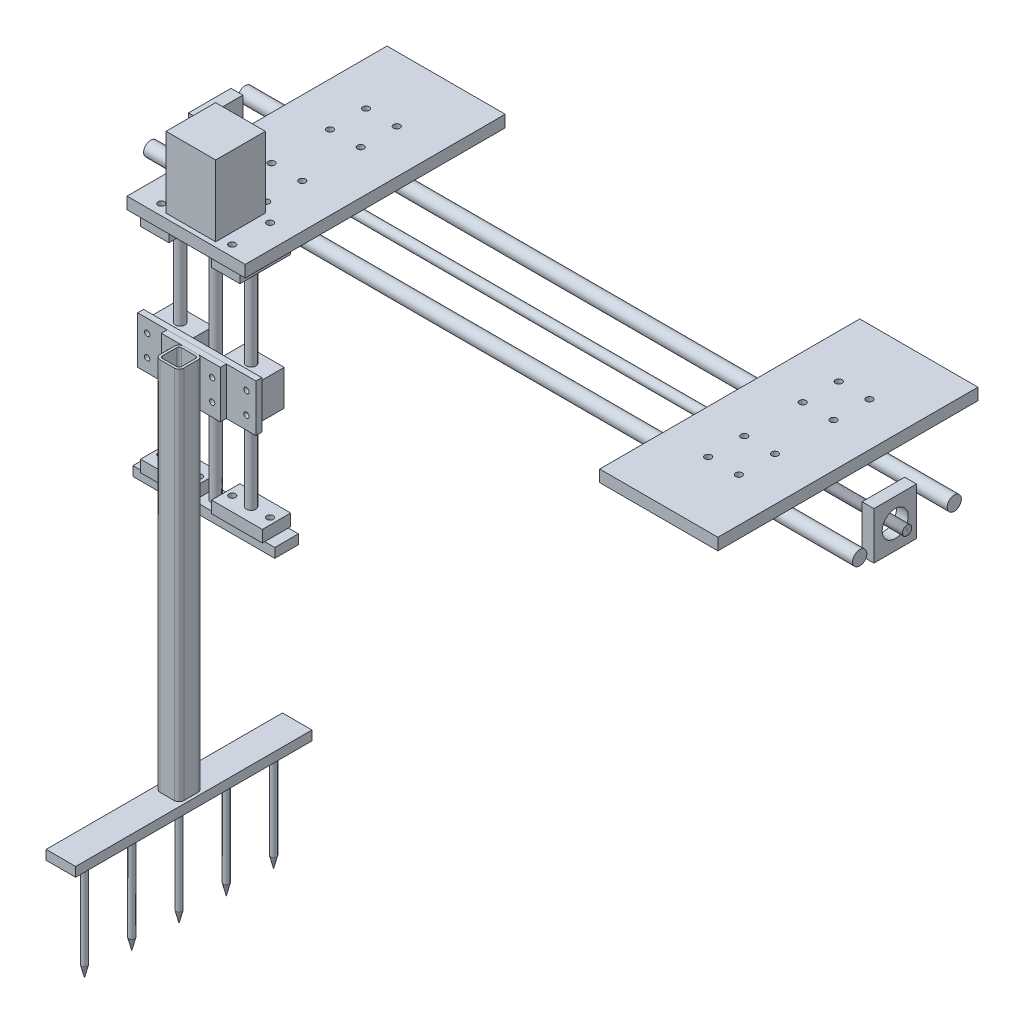
from build123d import *

# Parameters (mm, degrees)
CH_01_MAIN_FRAME_START                       = -260
CH_01_MAIN_FRAME_DEPTH                       = 520
CH_01_MAIN_FRAME_START_2                     = -106.066017178
CH_01_MAIN_FRAME_2_OUTLINE_W                 = 368.933982822
CH_01_MAIN_FRAME_2_OUTLINE_H                 = 22
CH_01_MAIN_FRAME_2_DEPTH                     = 15.066017178
CH_01_MAIN_FRAME_START_3                     = -475
CH_01_MAIN_FRAME_3_OUTLINE_W                 = 16.066017178
CH_01_MAIN_FRAME_3_OUTLINE_H                 = 22
CH_01_MAIN_FRAME_3_DEPTH                     = 368.933982822
CH_01_MAIN_FRAME_4_DEPTH                     = 375
CH_01_MAIN_FRAME_5_DEPTH                     = 375
CH_01_MAIN_FRAME_6_DEPTH                     = 375
CH_01_MAIN_FRAME_7_DEPTH                     = 375
CH_01_MAIN_FRAME_START_4                     = -410
CH_01_MAIN_FRAME_8_DEPTH                     = 820
CH_01_MAIN_FRAME_START_5                     = 106.066017178
CH_01_MAIN_FRAME_9_OUTLINE_W                 = 581.066017178
CH_01_MAIN_FRAME_9_OUTLINE_H                 = 22
CH_01_MAIN_FRAME_9_DEPTH                     = 14.933982822
CH_01_MAIN_FRAME_10_OUTLINE_W                = 15.933982822
CH_01_MAIN_FRAME_10_OUTLINE_H                = 22
CH_01_MAIN_FRAME_10_DEPTH                    = 581.066017178
CH_01_MAIN_FRAME_11_DEPTH                    = 520
CH_01_MAIN_FRAME_START_6                     = 91
CH_01_MAIN_FRAME_12_OUTLINE_W                = 368.933982822
CH_01_MAIN_FRAME_12_OUTLINE_H                = 22
CH_01_MAIN_FRAME_12_DEPTH                    = 15.066017178
CH_01_MAIN_FRAME_13_OUTLINE_W                = 16.066017178
CH_01_MAIN_FRAME_13_OUTLINE_H                = 22
CH_01_MAIN_FRAME_13_DEPTH                    = 368.933982822
CH_01_MAIN_FRAME_14_DEPTH                    = 820
CH_01_MAIN_FRAME_15_OUTLINE_W                = 581.066017178
CH_01_MAIN_FRAME_15_OUTLINE_H                = 22
CH_01_MAIN_FRAME_15_DEPTH                    = 14.933982822
CH_01_MAIN_FRAME_16_OUTLINE_W                = 15.933982822
CH_01_MAIN_FRAME_16_OUTLINE_H                = 22
CH_01_MAIN_FRAME_16_DEPTH                    = 581.066017178
SK_06_X_CARRIAGE_LAYOUT_W                    = 100
SK_06_X_CARRIAGE_LAYOUT_H                    = 220
XA_02_CARRIAGE_PLATES_DEPTH                  = 10
XA_02_CARRIAGE_PLATES_2_DEPTH                = 10
SK_08_X_RAIL_PROFILES_R                      = 6
XA_03_X_GUIDE_RAILS_DEPTH                    = 300
XA_03_X_GUIDE_RAILS_2_DEPTH                  = 300
XA_04_BEARING_HOUSING_01_START               = -200
SK_10_X_BEARING_PROFILE_W                    = 42
SK_10_X_BEARING_PROFILE_H                    = 28
SK_10_X_BEARING_PROFILE_R                    = 6
XA_04_BEARING_HOUSING_01_DEPTH               = 18
SK_11_X_BEARING_MOUNT_HOLES_R                = 2.75
XA_07_X_BEARING_MOUNT_HOLES_DEPTH            = 636.452594613
XA_09_RIGHT_CARRIAGE_HOLES_MIRROR_COPY_1_R   = 2.75
XA_09_RIGHT_CARRIAGE_HOLES_MIRROR_CO_2_DEPTH = 636.452594613
SK_12_X_LEAD_SCREW_PROFILE_R                 = 4
XA_10_X_LEAD_SCREW_DEPTH                     = 300
XA_11_LEFT_LEAD_NUT_START                    = -192.5
SK_13_X_LEAD_NUT_PROFILE_R                   = 5.1
SK_13_X_LEAD_NUT_PROFILE_R_2                 = 4
XA_11_LEFT_LEAD_NUT_DEPTH                    = 11.5
SK_15_LEFT_LEAD_NUT_FLANGE_PROFILE_R         = 11
SK_15_LEFT_LEAD_NUT_FLANGE_PROFILE_R_2       = 4
XA_15_LEFT_LEAD_NUT_FLANGE_DEPTH             = 3.5
SK_16_LEFT_LEAD_NUT_MOUNTING_HOLES_R         = 1.75
XA_16_LEFT_LEAD_NUT_MOUNTING_HOLES_DEPTH     = 3.5
SK_17_X_FIXED_END_SUPPORT_PROFILE_W          = 36
SK_17_X_FIXED_END_SUPPORT_PROFILE_H          = 40
SK_17_X_FIXED_END_SUPPORT_PROFILE_R          = 11
XA_18_X_FIXED_END_SUPPORT_DEPTH              = 10
ZA_02_LEFT_MOTOR_FOOTPRINT_W                 = 42
ZA_02_LEFT_MOTOR_FOOTPRINT_H                 = 42
ZA_03_LEFT_MOTOR_ENVELOPE_DEPTH              = 60
ZA_04_LEFT_LEAD_SCREW_PROFILE_R              = 4
ZA_05_LEFT_VERTICAL_LEAD_SCREW_DEPTH         = 200
ZA_07_LEFT_NUT_PROFILE_R                     = 5.1
ZA_07_LEFT_NUT_PROFILE_R_2                   = 4
ZA_08_LEFT_LEAD_NUT_DEPTH                    = 10
ZA_09_LEFT_GUIDE_ROD_PROFILES_R              = 4
ZA_10_LEFT_VERTICAL_GUIDE_RODS_DEPTH         = 200
ZA_10_LEFT_VERTICAL_GUIDE_RODS_2_DEPTH       = 200
ZA_12_LEFT_SC8UU_PROFILE_W                   = 34
ZA_12_LEFT_SC8UU_PROFILE_H                   = 22
ZA_12_LEFT_SC8UU_PROFILE_R                   = 4
ZA_13_LEFT_SC8UU_HOUSING_DEPTH               = 30
ZA_14_LEFT_SC8UU_MOUNTING_HOLES_PROFILE_R    = 2
ZA_15_LEFT_SC8UU_MOUNTING_HOLES_DEPTH        = 8
ZA_16_LEFT_SC8UU_BEARING_BLOCK_PATTERN_COUNT = 2
ZA_16_LEFT_SC8UU_BEARING_BLOCK_PATTERN_PITCH = 60
ZA_18_BRACKET_VERTICAL_PLATE_PROFILE_W       = 100
ZA_18_BRACKET_VERTICAL_PLATE_PROFILE_H       = 40
ZA_19_BRACKET_VERTICAL_PLATE_DEPTH           = 5
ZA_20_BRACKET_MOUNTING_HOLES_PROFILE_R       = 2.25
ZA_21_BRACKET_MOUNTING_HOLES_DEPTH           = 5
ZA_23_SHELF_PROFILE_W                        = 40
ZA_23_SHELF_PROFILE_H                        = 35
ZA_23_SHELF_PROFILE_R                        = 5
ZA_24_BRACKET_HORIZONTAL_SHELF_DEPTH         = 5
ZA_25_LEFT_NUT_FLANGE_PROFILE_R              = 11
ZA_25_LEFT_NUT_FLANGE_PROFILE_R_2            = 5.1
ZA_25_LEFT_NUT_FLANGE_PROFILE_R_3            = 4
ZA_26_LEFT_NUT_FLANGE_DEPTH                  = 3.5
ZA_27_LEFT_NUT_MOUNTING_HOLES_PROFILE_R      = 1.75
ZA_28_LEFT_NUT_MOUNTING_HOLES_DEPTH          = 3.5
ZA_29_SHELF_NUT_MOUNTING_HOLES_PROFILE_R     = 1.75
ZA_30_SHELF_NUT_MOUNTING_HOLES_DEPTH         = 5
ZA_31_LEFT_SHF8_PROFILE_W                    = 24
ZA_31_LEFT_SHF8_PROFILE_H                    = 43
ZA_31_LEFT_SHF8_PROFILE_R                    = 4
ZA_32_LEFT_SHF8_HOUSING_DEPTH                = 10
ZA_33_LEFT_SHF8_MOUNTING_HOLES_PROFILE_R     = 2.75
ZA_34_LEFT_SHF8_MOUNTING_HOLES_DEPTH         = 10
ZA_36_SHF8_CARRIAGE_MOUNTING_HOLES_R         = 2.75
ZA_37_SHF8_CARRIAGE_MOUNTING_CUT_DEPTH       = 630.046898093
ZA_39_LOWER_BAR_PROFILE_W                    = 120
ZA_39_LOWER_BAR_PROFILE_H                    = 20
ZA_40_LOWER_GUIDE_ROD_CROSSBAR_DEPTH         = 8
ZA_42_LOWER_LEFT_SHF8_ROTATION_ANGLE         = 90
ZA_44_LOWER_BAR_SHF8_MOUNTING_PROFILE_R      = 2.75
ZA_45_LOWER_BAR_SHF8_MOUNTING_CUT_DEPTH      = 556.517776493
RK_01_MOUNTING_FLANGE_PROFILE_W              = 50
RK_01_MOUNTING_FLANGE_PROFILE_H              = 40
RK_01_MOUNTING_FLANGE_PROFILE_R              = 2.25
RK_02_MOUNTING_FLANGE_DEPTH                  = 5
RK_05_SUPPORT_POST_DEPTH                     = 317
RK_08_RAKE_BAR_PROFILE_W                     = 25
RK_08_RAKE_BAR_PROFILE_H                     = 8
RK_09_RAKE_BAR_DEPTH                         = 200
RK_10_FIRST_TINE_PROFILE_R                   = 2.5
RK_11_FIRST_TINE_DEPTH                       = 90
RK_12_FIRST_TINE_TIP_SIZE                    = 10
RK_12_FIRST_TINE_TIP_SIZE2                   = 2.5


with BuildPart() as part:
    # CH_01_Main_Frame: read off the stored shape, not the designer's step
    # CH_01_Main_Frame outline → CH_01_Main_Frame (new body)
    with BuildSketch(Plane.XY.offset(CH_01_MAIN_FRAME_START)):
        with BuildLine():
            ThreePointArc((-390, 391), (-391.171572875, 393.828427125), (-394, 395))
            Line((-394, 395), (-406, 395))
            ThreePointArc((-406, 395), (-408.828427125, 393.828427125), (-410, 391))
            Line((-410, 391), (-410, 379))
            ThreePointArc((-410, 379), (-408.828427125, 376.171572875), (-406, 375))
            Line((-406, 375), (-394, 375))
            ThreePointArc((-394, 375), (-391.171572875, 376.171572875), (-390, 379))
            Line((-390, 379), (-390, 391))
        make_face()
        with BuildLine():
            Line((-408, 379), (-408, 391))
            ThreePointArc((-408, 391), (-407.414213562, 392.414213562), (-406, 393))
            Line((-406, 393), (-394, 393))
            ThreePointArc((-394, 393), (-392.585786438, 392.414213562), (-392, 391))
            Line((-392, 391), (-392, 379))
            ThreePointArc((-392, 379), (-392.585786438, 377.585786438), (-394, 377))
            Line((-394, 377), (-406, 377))
            ThreePointArc((-406, 377), (-407.414213562, 377.585786438), (-408, 379))
        make_face(mode=Mode.SUBTRACT)
    extrude(amount=CH_01_MAIN_FRAME_DEPTH)

    # CH_01_Main_Frame 2 outline → CH_01_Main_Frame 2 (cut)
    with BuildSketch(Plane(origin=(0, 0, 0), x_dir=(0.707106781186548, 0, -0.707106781186547), z_dir=(0.707106781186547, 0, 0.707106781186548)).offset(CH_01_MAIN_FRAME_START_2)):
        with Locations((-290.533008589, 385)):
            Rectangle(CH_01_MAIN_FRAME_2_OUTLINE_W, CH_01_MAIN_FRAME_2_OUTLINE_H)
    extrude(amount=CH_01_MAIN_FRAME_2_DEPTH, mode=Mode.SUBTRACT)

    # CH_01_Main_Frame 3 outline → CH_01_Main_Frame 3 (cut)
    with BuildSketch(Plane(origin=(0, 0, 0), x_dir=(0.707106781186548, 0, -0.707106781186547), z_dir=(0.707106781186547, 0, 0.707106781186548)).offset(CH_01_MAIN_FRAME_START_3)):
        with Locations((-98.033008589, 385)):
            Rectangle(CH_01_MAIN_FRAME_3_OUTLINE_W, CH_01_MAIN_FRAME_3_OUTLINE_H)
    extrude(amount=CH_01_MAIN_FRAME_3_DEPTH, mode=Mode.SUBTRACT)


with BuildPart() as body_2:
    # CH_01_Main_Frame 4 outline → CH_01_Main_Frame 4 (new body)
    with BuildSketch(Plane(origin=(0, 0, 0), x_dir=(1, 0, 0), z_dir=(0, 1, 0))):
        with BuildLine():
            ThreePointArc((-390, 256), (-391.171572875, 258.828427125), (-394, 260))
            Line((-394, 260), (-406, 260))
            ThreePointArc((-406, 260), (-408.828427125, 258.828427125), (-410, 256))
            Line((-410, 256), (-410, 244))
            ThreePointArc((-410, 244), (-408.828427125, 241.171572875), (-406, 240))
            Line((-406, 240), (-394, 240))
            ThreePointArc((-394, 240), (-391.171572875, 241.171572875), (-390, 244))
            Line((-390, 244), (-390, 256))
        make_face()
        with BuildLine():
            Line((-408, 244), (-408, 256))
            ThreePointArc((-408, 256), (-407.414213562, 257.414213562), (-406, 258))
            Line((-406, 258), (-394, 258))
            ThreePointArc((-394, 258), (-392.585786438, 257.414213562), (-392, 256))
            Line((-392, 256), (-392, 244))
            ThreePointArc((-392, 244), (-392.585786438, 242.585786438), (-394, 242))
            Line((-394, 242), (-406, 242))
            ThreePointArc((-406, 242), (-407.414213562, 242.585786438), (-408, 244))
        make_face(mode=Mode.SUBTRACT)
    extrude(amount=CH_01_MAIN_FRAME_4_DEPTH)


with BuildPart() as body_3:
    # CH_01_Main_Frame 5 outline → CH_01_Main_Frame 5 (new body)
    with BuildSketch(Plane(origin=(0, 0, 0), x_dir=(1, 0, 0), z_dir=(0, 1, 0))):
        with BuildLine():
            ThreePointArc((410, 256), (408.828427125, 258.828427125), (406, 260))
            Line((406, 260), (394, 260))
            ThreePointArc((394, 260), (391.171572875, 258.828427125), (390, 256))
            Line((390, 256), (390, 244))
            ThreePointArc((390, 244), (391.171572875, 241.171572875), (394, 240))
            Line((394, 240), (406, 240))
            ThreePointArc((406, 240), (408.828427125, 241.171572875), (410, 244))
            Line((410, 244), (410, 256))
        make_face()
        with BuildLine():
            Line((392, 244), (392, 256))
            ThreePointArc((392, 256), (392.585786438, 257.414213562), (394, 258))
            Line((394, 258), (406, 258))
            ThreePointArc((406, 258), (407.414213562, 257.414213562), (408, 256))
            Line((408, 256), (408, 244))
            ThreePointArc((408, 244), (407.414213562, 242.585786438), (406, 242))
            Line((406, 242), (394, 242))
            ThreePointArc((394, 242), (392.585786438, 242.585786438), (392, 244))
        make_face(mode=Mode.SUBTRACT)
    extrude(amount=CH_01_MAIN_FRAME_5_DEPTH)


with BuildPart() as body_4:
    # CH_01_Main_Frame 6 outline → CH_01_Main_Frame 6 (new body)
    with BuildSketch(Plane(origin=(0, 0, 0), x_dir=(1, 0, 0), z_dir=(0, 1, 0))):
        with BuildLine():
            ThreePointArc((410, -244), (408.828427125, -241.171572875), (406, -240))
            Line((406, -240), (394, -240))
            ThreePointArc((394, -240), (391.171572875, -241.171572875), (390, -244))
            Line((390, -244), (390, -256))
            ThreePointArc((390, -256), (391.171572875, -258.828427125), (394, -260))
            Line((394, -260), (406, -260))
            ThreePointArc((406, -260), (408.828427125, -258.828427125), (410, -256))
            Line((410, -256), (410, -244))
        make_face()
        with BuildLine():
            Line((392, -256), (392, -244))
            ThreePointArc((392, -244), (392.585786438, -242.585786438), (394, -242))
            Line((394, -242), (406, -242))
            ThreePointArc((406, -242), (407.414213562, -242.585786438), (408, -244))
            Line((408, -244), (408, -256))
            ThreePointArc((408, -256), (407.414213562, -257.414213562), (406, -258))
            Line((406, -258), (394, -258))
            ThreePointArc((394, -258), (392.585786438, -257.414213562), (392, -256))
        make_face(mode=Mode.SUBTRACT)
    extrude(amount=CH_01_MAIN_FRAME_6_DEPTH)


with BuildPart() as body_5:
    # CH_01_Main_Frame 7 outline → CH_01_Main_Frame 7 (new body)
    with BuildSketch(Plane(origin=(0, 0, 0), x_dir=(1, 0, 0), z_dir=(0, 1, 0))):
        with BuildLine():
            ThreePointArc((-390, -244), (-391.171572875, -241.171572875), (-394, -240))
            Line((-394, -240), (-406, -240))
            ThreePointArc((-406, -240), (-408.828427125, -241.171572875), (-410, -244))
            Line((-410, -244), (-410, -256))
            ThreePointArc((-410, -256), (-408.828427125, -258.828427125), (-406, -260))
            Line((-406, -260), (-394, -260))
            ThreePointArc((-394, -260), (-391.171572875, -258.828427125), (-390, -256))
            Line((-390, -256), (-390, -244))
        make_face()
        with BuildLine():
            Line((-408, -256), (-408, -244))
            ThreePointArc((-408, -244), (-407.414213562, -242.585786438), (-406, -242))
            Line((-406, -242), (-394, -242))
            ThreePointArc((-394, -242), (-392.585786438, -242.585786438), (-392, -244))
            Line((-392, -244), (-392, -256))
            ThreePointArc((-392, -256), (-392.585786438, -257.414213562), (-394, -258))
            Line((-394, -258), (-406, -258))
            ThreePointArc((-406, -258), (-407.414213562, -257.414213562), (-408, -256))
        make_face(mode=Mode.SUBTRACT)
    extrude(amount=CH_01_MAIN_FRAME_7_DEPTH)


with BuildPart() as body_6:
    # CH_01_Main_Frame 8 outline → CH_01_Main_Frame 8 (new body)
    with BuildSketch(Plane.YZ.offset(CH_01_MAIN_FRAME_START_4)):
        with BuildLine():
            Line((395, -256), (395, -244))
            ThreePointArc((395, -244), (393.828427125, -241.171572875), (391, -240))
            Line((391, -240), (379, -240))
            ThreePointArc((379, -240), (376.171572875, -241.171572875), (375, -244))
            Line((375, -244), (375, -256))
            ThreePointArc((375, -256), (376.171572875, -258.828427125), (379, -260))
            Line((379, -260), (391, -260))
            ThreePointArc((391, -260), (393.828427125, -258.828427125), (395, -256))
        make_face()
        with BuildLine():
            ThreePointArc((393, -256), (392.414213562, -257.414213562), (391, -258))
            Line((391, -258), (379, -258))
            ThreePointArc((379, -258), (377.585786438, -257.414213562), (377, -256))
            Line((377, -256), (377, -244))
            ThreePointArc((377, -244), (377.585786438, -242.585786438), (379, -242))
            Line((379, -242), (391, -242))
            ThreePointArc((391, -242), (392.414213562, -242.585786438), (393, -244))
            Line((393, -244), (393, -256))
        make_face(mode=Mode.SUBTRACT)
    extrude(amount=CH_01_MAIN_FRAME_8_DEPTH)

    # CH_01_Main_Frame 9 outline → CH_01_Main_Frame 9 (cut)
    with BuildSketch(Plane(origin=(0, 0, 0), x_dir=(0.707106781186548, 0, -0.707106781186547), z_dir=(0.707106781186547, 0, 0.707106781186548)).offset(CH_01_MAIN_FRAME_START_5)):
        with Locations((184.466991411, 385)):
            Rectangle(CH_01_MAIN_FRAME_9_OUTLINE_W, CH_01_MAIN_FRAME_9_OUTLINE_H)
    extrude(amount=CH_01_MAIN_FRAME_9_DEPTH, mode=Mode.SUBTRACT)

    # CH_01_Main_Frame 10 outline → CH_01_Main_Frame 10 (cut)
    with BuildSketch(Plane(origin=(0, 0, 0), x_dir=(0.707106781186548, 0, -0.707106781186547), z_dir=(0.707106781186547, 0, 0.707106781186548)).offset(CH_01_MAIN_FRAME_START_3)):
        with Locations((-114.033008589, 385)):
            Rectangle(CH_01_MAIN_FRAME_10_OUTLINE_W, CH_01_MAIN_FRAME_10_OUTLINE_H)
    extrude(amount=CH_01_MAIN_FRAME_10_DEPTH, mode=Mode.SUBTRACT)


with BuildPart() as body_7:
    # CH_01_Main_Frame 11 outline → CH_01_Main_Frame 11 (new body)
    with BuildSketch(Plane.XY.offset(CH_01_MAIN_FRAME_START)):
        with BuildLine():
            Line((406, 395), (394, 395))
            ThreePointArc((394, 395), (391.171572875, 393.828427125), (390, 391))
            Line((390, 391), (390, 379))
            ThreePointArc((390, 379), (391.171572875, 376.171572875), (394, 375))
            Line((394, 375), (406, 375))
            ThreePointArc((406, 375), (408.828427125, 376.171572875), (410, 379))
            Line((410, 379), (410, 391))
            ThreePointArc((410, 391), (408.828427125, 393.828427125), (406, 395))
        make_face()
        with BuildLine():
            ThreePointArc((406, 393), (407.414213562, 392.414213562), (408, 391))
            Line((408, 391), (408, 379))
            ThreePointArc((408, 379), (407.414213562, 377.585786438), (406, 377))
            Line((406, 377), (394, 377))
            ThreePointArc((394, 377), (392.585786438, 377.585786438), (392, 379))
            Line((392, 379), (392, 391))
            ThreePointArc((392, 391), (392.585786438, 392.414213562), (394, 393))
            Line((394, 393), (406, 393))
        make_face(mode=Mode.SUBTRACT)
    extrude(amount=CH_01_MAIN_FRAME_11_DEPTH)

    # CH_01_Main_Frame 12 outline → CH_01_Main_Frame 12 (cut)
    with BuildSketch(Plane(origin=(0, 0, 0), x_dir=(0.707106781186548, 0, -0.707106781186547), z_dir=(0.707106781186547, 0, 0.707106781186548)).offset(CH_01_MAIN_FRAME_START_6)):
        with Locations((290.533008589, 385)):
            Rectangle(CH_01_MAIN_FRAME_12_OUTLINE_W, CH_01_MAIN_FRAME_12_OUTLINE_H)
    extrude(amount=CH_01_MAIN_FRAME_12_DEPTH, mode=Mode.SUBTRACT)

    # CH_01_Main_Frame 13 outline → CH_01_Main_Frame 13 (cut)
    with BuildSketch(Plane(origin=(0, 0, 0), x_dir=(0.707106781186548, 0, -0.707106781186547), z_dir=(0.707106781186547, 0, 0.707106781186548)).offset(CH_01_MAIN_FRAME_START_5)):
        with Locations((98.033008589, 385)):
            Rectangle(CH_01_MAIN_FRAME_13_OUTLINE_W, CH_01_MAIN_FRAME_13_OUTLINE_H)
    extrude(amount=CH_01_MAIN_FRAME_13_DEPTH, mode=Mode.SUBTRACT)


with BuildPart() as body_8:
    # CH_01_Main_Frame 14 outline → CH_01_Main_Frame 14 (new body)
    with BuildSketch(Plane.YZ.offset(CH_01_MAIN_FRAME_START_4)):
        with BuildLine():
            ThreePointArc((391, 240), (393.828427125, 241.171572875), (395, 244))
            Line((395, 244), (395, 256))
            ThreePointArc((395, 256), (393.828427125, 258.828427125), (391, 260))
            Line((391, 260), (379, 260))
            ThreePointArc((379, 260), (376.171572875, 258.828427125), (375, 256))
            Line((375, 256), (375, 244))
            ThreePointArc((375, 244), (376.171572875, 241.171572875), (379, 240))
            Line((379, 240), (391, 240))
        make_face()
        with BuildLine():
            Line((379, 258), (391, 258))
            ThreePointArc((391, 258), (392.414213562, 257.414213562), (393, 256))
            Line((393, 256), (393, 244))
            ThreePointArc((393, 244), (392.414213562, 242.585786438), (391, 242))
            Line((391, 242), (379, 242))
            ThreePointArc((379, 242), (377.585786438, 242.585786438), (377, 244))
            Line((377, 244), (377, 256))
            ThreePointArc((377, 256), (377.585786438, 257.414213562), (379, 258))
        make_face(mode=Mode.SUBTRACT)
    extrude(amount=CH_01_MAIN_FRAME_14_DEPTH)

    # CH_01_Main_Frame 15 outline → CH_01_Main_Frame 15 (cut)
    with BuildSketch(Plane(origin=(0, 0, 0), x_dir=(0.7071067811865471, 0, 0.707106781186548), z_dir=(0.707106781186548, 0, -0.707106781186547)).offset(CH_01_MAIN_FRAME_START_5)):
        with Locations((184.466991411, -385)):
            Rectangle(CH_01_MAIN_FRAME_15_OUTLINE_W, CH_01_MAIN_FRAME_15_OUTLINE_H)
    extrude(amount=CH_01_MAIN_FRAME_15_DEPTH, mode=Mode.SUBTRACT)

    # CH_01_Main_Frame 16 outline → CH_01_Main_Frame 16 (cut)
    with BuildSketch(Plane(origin=(0, 0, 0), x_dir=(0.7071067811865471, 0, 0.707106781186548), z_dir=(0.707106781186548, 0, -0.707106781186547)).offset(CH_01_MAIN_FRAME_START_3)):
        with Locations((-114.033008589, -385)):
            Rectangle(CH_01_MAIN_FRAME_16_OUTLINE_W, CH_01_MAIN_FRAME_16_OUTLINE_H)
    extrude(amount=CH_01_MAIN_FRAME_16_DEPTH, mode=Mode.SUBTRACT)


with BuildPart() as body_9:
    # SK_06_X_Carriage_Layout → XA_02_Carriage_Plates (new body)
    with BuildSketch(Plane(origin=(0, 400, 0), x_dir=(1, 0, 0), z_dir=(0, 1, 0))):
        with Locations((-200, 0)):
            Rectangle(SK_06_X_CARRIAGE_LAYOUT_W, SK_06_X_CARRIAGE_LAYOUT_H)
    extrude(amount=XA_02_CARRIAGE_PLATES_DEPTH)

    # SK_11_X_Bearing_Mount_Holes → XA_07_X_Bearing_Mount_Holes (cut, through all)
    with BuildSketch(Plane(origin=(0, 410, 0), x_dir=(1, 0, 0), z_dir=(0, 1, 0))):
        with Locations(Location((-213, -24.75, 0), (0, 0, 270))):
            Circle(SK_11_X_BEARING_MOUNT_HOLES_R)
        with Locations(Location((-187, -24.75, 0), (0, 0, 270))):
            Circle(SK_11_X_BEARING_MOUNT_HOLES_R)
        with Locations(Location((-187, -55.25, 0), (0, 0, 270))):
            Circle(SK_11_X_BEARING_MOUNT_HOLES_R)
        with Locations(Location((-213, -55.25, 0), (0, 0, 270))):
            Circle(SK_11_X_BEARING_MOUNT_HOLES_R)
    xa_07_x_bearing_mount_holes = extrude(amount=-XA_07_X_BEARING_MOUNT_HOLES_DEPTH, mode=Mode.SUBTRACT)

    # XA_08_X_Bearing_Holes_Mirror: XA_07_X_Bearing_Mount_Holes across plane
    add(xa_07_x_bearing_mount_holes.mirror(Plane.XY), mode=Mode.SUBTRACT)

    # ZA_36_SHF8_Carriage_Mounting_Holes → ZA_37_SHF8_Carriage_Mounting_Cut (cut, through all)
    with BuildSketch(Plane.XZ.offset(-400)):
        with Locations(Location((-170, 69, 0), (0, 0, 270))):
            Circle(ZA_36_SHF8_CARRIAGE_MOUNTING_HOLES_R)
        with Locations(Location((-170, 101, 0), (0, 0, 270))):
            Circle(ZA_36_SHF8_CARRIAGE_MOUNTING_HOLES_R)
        with Locations(Location((-230, 69, 0), (0, 0, 270))):
            Circle(ZA_36_SHF8_CARRIAGE_MOUNTING_HOLES_R)
        with Locations(Location((-230, 101, 0), (0, 0, 270))):
            Circle(ZA_36_SHF8_CARRIAGE_MOUNTING_HOLES_R)
    extrude(amount=-ZA_37_SHF8_CARRIAGE_MOUNTING_CUT_DEPTH, mode=Mode.SUBTRACT)


with BuildPart() as body_10:
    # SK_06_X_Carriage_Layout → XA_02_Carriage_Plates 2 (new body)
    with BuildSketch(Plane(origin=(0, 400, 0), x_dir=(1, 0, 0), z_dir=(0, 1, 0))):
        with Locations((200, 0)):
            Rectangle(SK_06_X_CARRIAGE_LAYOUT_W, SK_06_X_CARRIAGE_LAYOUT_H)
    extrude(amount=XA_02_CARRIAGE_PLATES_2_DEPTH)

    # XA_09_Right_Carriage_Holes_Mirror: XA_07_X_Bearing_Mount_Holes across plane
    add(xa_07_x_bearing_mount_holes.mirror(Plane(origin=(0, 0, 0), x_dir=(0, 0, 1), z_dir=(1, 0, 0))), mode=Mode.SUBTRACT)

    # XA_09_Right_Carriage_Holes_Mirror copy 1 → XA_09_Right_Carriage_Holes_Mirror co 2 (cut, through all)
    with BuildSketch(Plane(origin=(0, 410, 0), x_dir=(-1, 0, 0), z_dir=(0, 1, 0))):
        with Locations(Location((-213, -24.75, 0), (0, 0, 270))):
            Circle(XA_09_RIGHT_CARRIAGE_HOLES_MIRROR_COPY_1_R)
        with Locations(Location((-187, -24.75, 0), (0, 0, 270))):
            Circle(XA_09_RIGHT_CARRIAGE_HOLES_MIRROR_COPY_1_R)
        with Locations(Location((-187, -55.25, 0), (0, 0, 270))):
            Circle(XA_09_RIGHT_CARRIAGE_HOLES_MIRROR_COPY_1_R)
        with Locations(Location((-213, -55.25, 0), (0, 0, 270))):
            Circle(XA_09_RIGHT_CARRIAGE_HOLES_MIRROR_COPY_1_R)
    extrude(amount=-XA_09_RIGHT_CARRIAGE_HOLES_MIRROR_CO_2_DEPTH, mode=Mode.SUBTRACT)


with BuildPart() as body_11:
    # SK_08_X_Rail_Profiles → XA_03_X_Guide_Rails (new, symmetric)
    with BuildSketch(Plane(origin=(0, 0, 0), x_dir=(0, 0, -1), z_dir=(1, 0, 0))):
        with Locations((40, 385)):
            Circle(SK_08_X_RAIL_PROFILES_R)
    extrude(amount=XA_03_X_GUIDE_RAILS_DEPTH, both=True)


with BuildPart() as body_12:
    # SK_08_X_Rail_Profiles → XA_03_X_Guide_Rails 2 (new, symmetric)
    with BuildSketch(Plane(origin=(0, 0, 0), x_dir=(0, 0, -1), z_dir=(1, 0, 0))):
        with Locations((-40, 385)):
            Circle(SK_08_X_RAIL_PROFILES_R)
    extrude(amount=XA_03_X_GUIDE_RAILS_2_DEPTH, both=True)


with BuildPart() as body_13:
    # SK_10_X_Bearing_Profile → XA_04_Bearing_Housing_01 (new, symmetric)
    with BuildSketch(Plane(origin=(0, 0, 0), x_dir=(0, 0, -1), z_dir=(1, 0, 0)).offset(XA_04_BEARING_HOUSING_01_START)):
        with Locations((-40, 386)):
            Rectangle(SK_10_X_BEARING_PROFILE_W, SK_10_X_BEARING_PROFILE_H)
        with Locations((-40, 385)):
            Circle(SK_10_X_BEARING_PROFILE_R, mode=Mode.SUBTRACT)
    extrude(amount=XA_04_BEARING_HOUSING_01_DEPTH, both=True)


with BuildPart() as body_14:
    # XA_05_Left_Carriage_Bearing_Mirror: mirrored copy
    add(body_13.part.mirror(Plane.XY))


with BuildPart() as body_15:
    # XA_06_Right_Carriage_Bearing_Mirror: mirrored copy
    add(body_13.part.mirror(Plane(origin=(0, 0, 0), x_dir=(0, 0, 1), z_dir=(1, 0, 0))))


with BuildPart() as body_16:
    # XA_06_Right_Carriage_Bearing_Mirror 2: mirrored copy
    add(body_14.part.mirror(Plane(origin=(0, 0, 0), x_dir=(0, 0, 1), z_dir=(1, 0, 0))))


with BuildPart() as body_17:
    # SK_12_X_Lead_Screw_Profile → XA_10_X_Lead_Screw (new, symmetric)
    with BuildSketch(Plane(origin=(0, 0, 0), x_dir=(0, 0, -1), z_dir=(1, 0, 0))):
        with Locations((0, 385)):
            Circle(SK_12_X_LEAD_SCREW_PROFILE_R)
    extrude(amount=XA_10_X_LEAD_SCREW_DEPTH, both=True)



with BuildPart() as body_18:
    # SK_13_X_Lead_Nut_Profile → XA_11_Left_Lead_Nut (new body)
    with BuildSketch(Plane(origin=(0, 0, 0), x_dir=(0, 0, -1), z_dir=(1, 0, 0)).offset(XA_11_LEFT_LEAD_NUT_START)):
        with Locations((0, 385)):
            Circle(SK_13_X_LEAD_NUT_PROFILE_R)
        with Locations((0, 385)):
            Circle(SK_13_X_LEAD_NUT_PROFILE_R_2, mode=Mode.SUBTRACT)
    extrude(amount=-XA_11_LEFT_LEAD_NUT_DEPTH)


with BuildPart() as body_17_1:
    add(body_17.part)

    add(body_18.part)  # XA_15_Left_Lead_Nut_Flange merges body 18
    # SK_15_Left_Lead_Nut_Flange_Profile → XA_15_Left_Lead_Nut_Flange (add)
    with BuildSketch(Plane.ZY.offset(204)):
        with Locations((0, 385)):
            Circle(SK_15_LEFT_LEAD_NUT_FLANGE_PROFILE_R)
        with Locations((0, 385)):
            Circle(SK_15_LEFT_LEAD_NUT_FLANGE_PROFILE_R_2, mode=Mode.SUBTRACT)
    extrude(amount=XA_15_LEFT_LEAD_NUT_FLANGE_DEPTH)

    # SK_16_Left_Lead_Nut_Mounting_Holes → XA_16_Left_Lead_Nut_Mounting_Holes (cut)
    with BuildSketch(Plane.ZY.offset(207.5)):
        with Locations((0, 393)):
            Circle(SK_16_LEFT_LEAD_NUT_MOUNTING_HOLES_R)
        with Locations((8, 385)):
            Circle(SK_16_LEFT_LEAD_NUT_MOUNTING_HOLES_R)
        with Locations((-8, 385)):
            Circle(SK_16_LEFT_LEAD_NUT_MOUNTING_HOLES_R)
        with Locations((0, 377)):
            Circle(SK_16_LEFT_LEAD_NUT_MOUNTING_HOLES_R)
    extrude(amount=-XA_16_LEFT_LEAD_NUT_MOUNTING_HOLES_DEPTH, mode=Mode.SUBTRACT)


with BuildPart() as body_18_2:
    # XA_12_Right_Lead_Nut_Mirror: mirrored copy
    add(body_17_1.part.mirror(Plane(origin=(0, 0, 0), x_dir=(0, 0, 1), z_dir=(1, 0, 0))))


with BuildPart() as body_19:
    # SK_17_X_Fixed_End_Support_Profile → XA_18_X_Fixed_End_Support (new body)
    with BuildSketch(Plane(origin=(280, 0, 0), x_dir=(0, 0, -1), z_dir=(1, 0, 0))):
        with Locations((0, 385)):
            Rectangle(SK_17_X_FIXED_END_SUPPORT_PROFILE_W, SK_17_X_FIXED_END_SUPPORT_PROFILE_H)
        with Locations((0, 385)):
            Circle(SK_17_X_FIXED_END_SUPPORT_PROFILE_R, mode=Mode.SUBTRACT)
    extrude(amount=XA_18_X_FIXED_END_SUPPORT_DEPTH)


with BuildPart() as body_20:
    # XA_19_X_Floating_End_Support_Mirror: mirrored copy
    add(body_19.part.mirror(Plane(origin=(0, 0, 0), x_dir=(0, 0, 1), z_dir=(1, 0, 0))))


with BuildPart() as body_21:
    # ZA_02_Left_Motor_Footprint → ZA_03_Left_Motor_Envelope (new body)
    with BuildSketch(Plane(origin=(0, 410, 0), x_dir=(1, 0, 0), z_dir=(0, 1, 0))):
        with Locations((-200, -85)):
            Rectangle(ZA_02_LEFT_MOTOR_FOOTPRINT_W, ZA_02_LEFT_MOTOR_FOOTPRINT_H)
    extrude(amount=ZA_03_LEFT_MOTOR_ENVELOPE_DEPTH)


with BuildPart() as body_22:
    # ZA_04_Left_Lead_Screw_Profile → ZA_05_Left_Vertical_Lead_Screw (new body)
    with BuildSketch(Plane.XZ.offset(-400)):
        with Locations(Location((-200, 85, 0), (0, 0, 270))):
            Circle(ZA_04_LEFT_LEAD_SCREW_PROFILE_R)
    extrude(amount=ZA_05_LEFT_VERTICAL_LEAD_SCREW_DEPTH)



with BuildPart() as body_23:
    # ZA_07_Left_Nut_Profile → ZA_08_Left_Lead_Nut (new body)
    with BuildSketch(Plane(origin=(0, 288.5, 0), x_dir=(1, 0, 0), z_dir=(0, 1, 0))):
        with Locations(Location((-200, -85, 0), (0, 0, 270))):
            Circle(ZA_07_LEFT_NUT_PROFILE_R)
        with Locations(Location((-200, -85, 0), (0, 0, 90))):
            Circle(ZA_07_LEFT_NUT_PROFILE_R_2, mode=Mode.SUBTRACT)
    extrude(amount=ZA_08_LEFT_LEAD_NUT_DEPTH)


with BuildPart() as body_24:
    # ZA_09_Left_Guide_Rod_Profiles → ZA_10_Left_Vertical_Guide_Rods (new body)
    with BuildSketch(Plane.XZ.offset(-400)):
        with Locations(Location((-230, 85, 0), (0, 0, 270))):
            Circle(ZA_09_LEFT_GUIDE_ROD_PROFILES_R)
    extrude(amount=ZA_10_LEFT_VERTICAL_GUIDE_RODS_DEPTH)


with BuildPart() as body_25:
    # ZA_09_Left_Guide_Rod_Profiles → ZA_10_Left_Vertical_Guide_Rods 2 (new body)
    with BuildSketch(Plane.XZ.offset(-400)):
        with Locations(Location((-170, 85, 0), (0, 0, 270))):
            Circle(ZA_09_LEFT_GUIDE_ROD_PROFILES_R)
    extrude(amount=ZA_10_LEFT_VERTICAL_GUIDE_RODS_2_DEPTH)


with BuildPart() as body_26:
    # ZA_12_Left_SC8UU_Profile → ZA_13_Left_SC8UU_Housing (new body)
    with BuildSketch(Plane(origin=(0, 315, 0), x_dir=(1, 0, 0), z_dir=(0, 1, 0))):
        with Locations((-230, -85)):
            Rectangle(ZA_12_LEFT_SC8UU_PROFILE_W, ZA_12_LEFT_SC8UU_PROFILE_H)
        with Locations(Location((-230, -85, 0), (0, 0, 270))):
            Circle(ZA_12_LEFT_SC8UU_PROFILE_R, mode=Mode.SUBTRACT)
    extrude(amount=-ZA_13_LEFT_SC8UU_HOUSING_DEPTH)

    # ZA_14_Left_SC8UU_Mounting_Holes_Profile → ZA_15_Left_SC8UU_Mounting_Holes (cut)
    with BuildSketch(Plane.XY.offset(96)):
        with Locations((-242, 309)):
            Circle(ZA_14_LEFT_SC8UU_MOUNTING_HOLES_PROFILE_R)
        with Locations((-242, 291)):
            Circle(ZA_14_LEFT_SC8UU_MOUNTING_HOLES_PROFILE_R)
        with Locations((-218, 291)):
            Circle(ZA_14_LEFT_SC8UU_MOUNTING_HOLES_PROFILE_R)
        with Locations((-218, 309)):
            Circle(ZA_14_LEFT_SC8UU_MOUNTING_HOLES_PROFILE_R)
    extrude(amount=-ZA_15_LEFT_SC8UU_MOUNTING_HOLES_DEPTH, mode=Mode.SUBTRACT)


with BuildPart() as za_16_left_sc8uu_bearing_block_pattern_1:
    # ZA_16_Left_SC8UU_Bearing_Block_Pattern: pattern copy
    add(body_26.part.moved(Location(Vector(1, 0, 0) * (1 * ZA_16_LEFT_SC8UU_BEARING_BLOCK_PATTERN_PITCH))))


with BuildPart() as body_28:
    # ZA_18_Bracket_Vertical_Plate_Profile → ZA_19_Bracket_Vertical_Plate (new body)
    with BuildSketch(Plane.XY.offset(96)):
        with Locations((-200, 300)):
            Rectangle(ZA_18_BRACKET_VERTICAL_PLATE_PROFILE_W, ZA_18_BRACKET_VERTICAL_PLATE_PROFILE_H)
    extrude(amount=ZA_19_BRACKET_VERTICAL_PLATE_DEPTH)

    # ZA_20_Bracket_Mounting_Holes_Profile → ZA_21_Bracket_Mounting_Holes (cut)
    with BuildSketch(Plane.XY.offset(101)):
        with Locations((-242, 309)):
            Circle(ZA_20_BRACKET_MOUNTING_HOLES_PROFILE_R)
        with Locations((-218, 309)):
            Circle(ZA_20_BRACKET_MOUNTING_HOLES_PROFILE_R)
        with Locations((-242, 291)):
            Circle(ZA_20_BRACKET_MOUNTING_HOLES_PROFILE_R)
        with Locations((-218, 291)):
            Circle(ZA_20_BRACKET_MOUNTING_HOLES_PROFILE_R)
        with Locations((-182, 291)):
            Circle(ZA_20_BRACKET_MOUNTING_HOLES_PROFILE_R)
        with Locations((-182, 309)):
            Circle(ZA_20_BRACKET_MOUNTING_HOLES_PROFILE_R)
        with Locations((-158, 309)):
            Circle(ZA_20_BRACKET_MOUNTING_HOLES_PROFILE_R)
        with Locations((-158, 291)):
            Circle(ZA_20_BRACKET_MOUNTING_HOLES_PROFILE_R)
    extrude(amount=-ZA_21_BRACKET_MOUNTING_HOLES_DEPTH, mode=Mode.SUBTRACT)


with BuildPart() as body_26_1:
    add(body_26.part)

    add(za_16_left_sc8uu_bearing_block_pattern_1.part)  # ZA_24_Bracket_Horizontal_Shelf merges ZA_16_Left_SC8UU_Bearing_Block_Pattern_1

    add(body_28.part)  # ZA_24_Bracket_Horizontal_Shelf merges body 28
    # ZA_23_Shelf_Profile → ZA_24_Bracket_Horizontal_Shelf (add)
    with BuildSketch(Plane(origin=(0, 285, 0), x_dir=(1, 0, 0), z_dir=(0, 1, 0))):
        with Locations((-200, -78.5)):
            Rectangle(ZA_23_SHELF_PROFILE_W, ZA_23_SHELF_PROFILE_H)
        with Locations(Location((-200, -85, 0), (0, 0, 270))):
            Circle(ZA_23_SHELF_PROFILE_R, mode=Mode.SUBTRACT)
    extrude(amount=-ZA_24_BRACKET_HORIZONTAL_SHELF_DEPTH)

    # ZA_29_Shelf_Nut_Mounting_Holes_Profile → ZA_30_Shelf_Nut_Mounting_Holes (cut)
    with BuildSketch(Plane(origin=(0, 285, 0), x_dir=(1, 0, 0), z_dir=(0, 1, 0))):
        with Locations(Location((-200, -93, 0), (0, 0, 270))):
            Circle(ZA_29_SHELF_NUT_MOUNTING_HOLES_PROFILE_R)
        with Locations(Location((-192, -85, 0), (0, 0, 270))):
            Circle(ZA_29_SHELF_NUT_MOUNTING_HOLES_PROFILE_R)
        with Locations(Location((-200, -77, 0), (0, 0, 270))):
            Circle(ZA_29_SHELF_NUT_MOUNTING_HOLES_PROFILE_R)
        with Locations(Location((-208, -85, 0), (0, 0, 270))):
            Circle(ZA_29_SHELF_NUT_MOUNTING_HOLES_PROFILE_R)
    extrude(amount=-ZA_30_SHELF_NUT_MOUNTING_HOLES_DEPTH, mode=Mode.SUBTRACT)


with BuildPart() as body_22_1:
    add(body_22.part)

    add(body_23.part)  # ZA_26_Left_Nut_Flange merges body 23
    # ZA_25_Left_Nut_Flange_Profile → ZA_26_Left_Nut_Flange (add)
    # profile 1 of 2: a face of its own
    with BuildSketch(Plane.XZ.offset(-288.5)):
        with Locations(Location((-200, 85, 0), (0, 0, 270))):
            Circle(ZA_25_LEFT_NUT_FLANGE_PROFILE_R)
        with Locations(Location((-200, 85, 0), (0, 0, 270))):
            Circle(ZA_25_LEFT_NUT_FLANGE_PROFILE_R_2, mode=Mode.SUBTRACT)
    # profile 2 of 2: a face of its own
    with BuildSketch(Plane.XZ.offset(-288.5)):
        with Locations(Location((-200, 85, 0), (0, 0, 270))):
            Circle(ZA_25_LEFT_NUT_FLANGE_PROFILE_R_2)
        with Locations(Location((-200, 85, 0), (0, 0, 270))):
            Circle(ZA_25_LEFT_NUT_FLANGE_PROFILE_R_3, mode=Mode.SUBTRACT)
    extrude(amount=ZA_26_LEFT_NUT_FLANGE_DEPTH)

    # ZA_27_Left_Nut_Mounting_Holes_Profile → ZA_28_Left_Nut_Mounting_Holes (cut)
    with BuildSketch(Plane(origin=(0, 288.5, 0), x_dir=(1, 0, 0), z_dir=(0, 1, 0))):
        with Locations(Location((-200, -77, 0), (0, 0, 270))):
            Circle(ZA_27_LEFT_NUT_MOUNTING_HOLES_PROFILE_R)
        with Locations(Location((-192, -85, 0), (0, 0, 270))):
            Circle(ZA_27_LEFT_NUT_MOUNTING_HOLES_PROFILE_R)
        with Locations(Location((-208, -85, 0), (0, 0, 270))):
            Circle(ZA_27_LEFT_NUT_MOUNTING_HOLES_PROFILE_R)
        with Locations(Location((-200, -93, 0), (0, 0, 270))):
            Circle(ZA_27_LEFT_NUT_MOUNTING_HOLES_PROFILE_R)
    extrude(amount=-ZA_28_LEFT_NUT_MOUNTING_HOLES_DEPTH, mode=Mode.SUBTRACT)


with BuildPart() as body_26_2:
    # ZA_31_Left_SHF8_Profile → ZA_32_Left_SHF8_Housing (new body)
    with BuildSketch(Plane.XZ.offset(-400)):
        with Locations((-170, 85)):
            Rectangle(ZA_31_LEFT_SHF8_PROFILE_W, ZA_31_LEFT_SHF8_PROFILE_H)
        with Locations(Location((-170, 85, 0), (0, 0, 270))):
            Circle(ZA_31_LEFT_SHF8_PROFILE_R, mode=Mode.SUBTRACT)
    extrude(amount=ZA_32_LEFT_SHF8_HOUSING_DEPTH)

    # ZA_33_Left_SHF8_Mounting_Holes_Profile → ZA_34_Left_SHF8_Mounting_Holes (cut)
    with BuildSketch(Plane.XZ.offset(-390)):
        with Locations(Location((-170, 101, 0), (0, 0, 270))):
            Circle(ZA_33_LEFT_SHF8_MOUNTING_HOLES_PROFILE_R)
        with Locations(Location((-170, 69, 0), (0, 0, 270))):
            Circle(ZA_33_LEFT_SHF8_MOUNTING_HOLES_PROFILE_R)
    extrude(amount=-ZA_34_LEFT_SHF8_MOUNTING_HOLES_DEPTH, mode=Mode.SUBTRACT)


with BuildPart() as body_27:
    # ZA_35_Right_SHF8_Copy: copy of body 26 2
    add(body_26_2.part.moved(Location((-60, 0, 0))))


with BuildPart() as body_28_2:
    # ZA_39_Lower_Bar_Profile → ZA_40_Lower_Guide_Rod_Crossbar (new body)
    with BuildSketch(Plane(origin=(0, 200, 0), x_dir=(1, 0, 0), z_dir=(0, 1, 0))):
        with Locations((-200, -85)):
            Rectangle(ZA_39_LOWER_BAR_PROFILE_W, ZA_39_LOWER_BAR_PROFILE_H)
    extrude(amount=-ZA_40_LOWER_GUIDE_ROD_CROSSBAR_DEPTH)

    # ZA_44_Lower_Bar_SHF8_Mounting_Profile → ZA_45_Lower_Bar_SHF8_Mounting_Cut (cut, through all)
    with BuildSketch(Plane(origin=(0, 200, 0), x_dir=(1, 0, 0), z_dir=(0, 1, 0))):
        with Locations(Location((-186, -85, 0), (0, 0, 180))):
            Circle(ZA_44_LOWER_BAR_SHF8_MOUNTING_PROFILE_R)
        with Locations(Location((-214, -85, 0), (0, 0, 180))):
            Circle(ZA_44_LOWER_BAR_SHF8_MOUNTING_PROFILE_R)
        with Locations(Location((-154, -85, 0), (0, 0, 180))):
            Circle(ZA_44_LOWER_BAR_SHF8_MOUNTING_PROFILE_R)
        with Locations(Location((-246, -85, 0), (0, 0, 180))):
            Circle(ZA_44_LOWER_BAR_SHF8_MOUNTING_PROFILE_R)
    extrude(amount=-ZA_45_LOWER_BAR_SHF8_MOUNTING_CUT_DEPTH, mode=Mode.SUBTRACT)


with BuildPart() as body_29:
    # ZA_41_Lower_Left_SHF8_Copy: copy of body 26 2
    add(body_26_2.part.moved(Location((0, -190, 0))))


with BuildPart() as body_29_1:
    # ZA_42_Lower_Left_SHF8_Rotation: moved
    add(body_29.part.rotate(Axis((-170, 0, 85), (0, 1, 0)), ZA_42_LOWER_LEFT_SHF8_ROTATION_ANGLE))


with BuildPart() as body_30:
    # ZA_43_Lower_Right_SHF8_Copy: copy of body 29
    add(body_29_1.part.moved(Location((-60, 0, 0))))


with BuildPart() as body_31:
    # RK_01_Mounting_Flange_Profile → RK_02_Mounting_Flange (new body)
    with BuildSketch(Plane.XY.offset(101)):
        with Locations((-200, 300)):
            Rectangle(RK_01_MOUNTING_FLANGE_PROFILE_W, RK_01_MOUNTING_FLANGE_PROFILE_H)
        with Locations((-218, 291)):
            Circle(RK_01_MOUNTING_FLANGE_PROFILE_R, mode=Mode.SUBTRACT)
        with Locations((-182, 291)):
            Circle(RK_01_MOUNTING_FLANGE_PROFILE_R, mode=Mode.SUBTRACT)
        with Locations((-182, 309)):
            Circle(RK_01_MOUNTING_FLANGE_PROFILE_R, mode=Mode.SUBTRACT)
        with Locations((-218, 309)):
            Circle(RK_01_MOUNTING_FLANGE_PROFILE_R, mode=Mode.SUBTRACT)
    extrude(amount=RK_02_MOUNTING_FLANGE_DEPTH)


with BuildPart() as body_32:
    # Sketch17 → RK_05_Support_Post (new body)
    with BuildSketch(Plane(origin=(-200, 320, 116), x_dir=(1, 0, 0), z_dir=(0, -1, 0))):
        with BuildLine():
            Line((-6, -10), (6, -10))
            ThreePointArc((6, -10), (8.828427125, -8.828427125), (10, -6))
            Line((10, -6), (10, 6))
            ThreePointArc((10, 6), (8.828427125, 8.828427125), (6, 10))
            Line((6, 10), (-6, 10))
            ThreePointArc((-6, 10), (-8.828427125, 8.828427125), (-10, 6))
            Line((-10, 6), (-10, -6))
            ThreePointArc((-10, -6), (-8.828427125, -8.828427125), (-6, -10))
        make_face()
        with BuildLine():
            Line((-6, -8), (6, -8))
            ThreePointArc((6, -8), (7.414213562, -7.414213562), (8, -6))
            Line((8, -6), (8, 6))
            ThreePointArc((8, 6), (7.414213562, 7.414213562), (6, 8))
            Line((6, 8), (-6, 8))
            ThreePointArc((-6, 8), (-7.414213562, 7.414213562), (-8, 6))
            Line((-8, 6), (-8, -6))
            ThreePointArc((-8, -6), (-7.414213562, -7.414213562), (-6, -8))
        make_face(mode=Mode.SUBTRACT)
    extrude(amount=RK_05_SUPPORT_POST_DEPTH)


with BuildPart() as body_33:
    # RK_08_Rake_Bar_Profile → RK_09_Rake_Bar (new body)
    with BuildSketch(Plane.XY.offset(16)):
        with Locations((-200, -1)):
            Rectangle(RK_08_RAKE_BAR_PROFILE_W, RK_08_RAKE_BAR_PROFILE_H)
    extrude(amount=RK_09_RAKE_BAR_DEPTH)

    # RK_10_First_Tine_Profile → RK_11_First_Tine (add)
    with BuildSketch(Plane.XZ.offset(5)):
        with Locations(Location((-200, 196, 0), (0, 0, 180))):
            Circle(RK_10_FIRST_TINE_PROFILE_R)
    extrude(amount=RK_11_FIRST_TINE_DEPTH)

    # RK_12_First_Tine_Tip
    rk_12_first_tine_tip_edges = [body_33.edges().sort_by_distance(p)[0] for p in [
        (-197.5, -95, 196),
    ]]
    rk_12_first_tine_tip_side = [body_33.faces().sort_by_distance(p)[0] for p in [
        (-197.5, -50, 196),
    ]]
    chamfer(rk_12_first_tine_tip_edges, length=RK_12_FIRST_TINE_TIP_SIZE, length2=RK_12_FIRST_TINE_TIP_SIZE2, reference=rk_12_first_tine_tip_side[0])

    # RK_13_Tine_Linear_Pattern: read off the stored shape, not the designer's step
    # RK_13_Tine_Linear_Pattern outline → RK_13_Tine_Linear_Pattern (revolve)
    with BuildSketch(Plane(origin=(-200, 0, 36), x_dir=(1, 0, 0), z_dir=(0, 0, 1))):
        Polygon((0, -5), (0, -95), (2.5, -85), (2.5, -5), align=None)
    revolve(axis=Axis((-200, 0, 36), (0, 1, 0)))

    # RK_13_Tine_Linear_Pattern 2 outline → RK_13_Tine_Linear_Pattern 2 (revolve)
    with BuildSketch(Plane(origin=(-200, 0, 76), x_dir=(1, 0, 0), z_dir=(0, 0, 1))):
        Polygon((0, -5), (0, -95), (2.5, -85), (2.5, -5), align=None)
    revolve(axis=Axis((-200, 0, 76), (0, 1, 0)))

    # RK_13_Tine_Linear_Pattern 3 outline → RK_13_Tine_Linear_Pattern 3 (revolve)
    with BuildSketch(Plane(origin=(-200, 0, 116), x_dir=(1, 0, 0), z_dir=(0, 0, 1))):
        Polygon((0, -5), (0, -95), (2.5, -85), (2.5, -5), align=None)
    revolve(axis=Axis((-200, 0, 116), (0, 1, 0)))

    # RK_13_Tine_Linear_Pattern 4 outline → RK_13_Tine_Linear_Pattern 4 (revolve)
    with BuildSketch(Plane(origin=(-200, 0, 156), x_dir=(1, 0, 0), z_dir=(0, 0, 1))):
        Polygon((0, -95), (2.5, -85), (2.5, -5), (0, -5), align=None)
    revolve(axis=Axis((-200, 0, 156), (0, 1, 0)))


solid = Compound([body_9.part, body_10.part, body_11.part, body_12.part, body_13.part, body_14.part, body_15.part, body_16.part, body_17_1.part, body_18_2.part, body_19.part, body_20.part, body_21.part, body_24.part, body_25.part, body_26_1.part, body_22_1.part, body_26_2.part, body_27.part, body_28_2.part, body_29_1.part, body_30.part, body_31.part, body_32.part, body_33.part])
